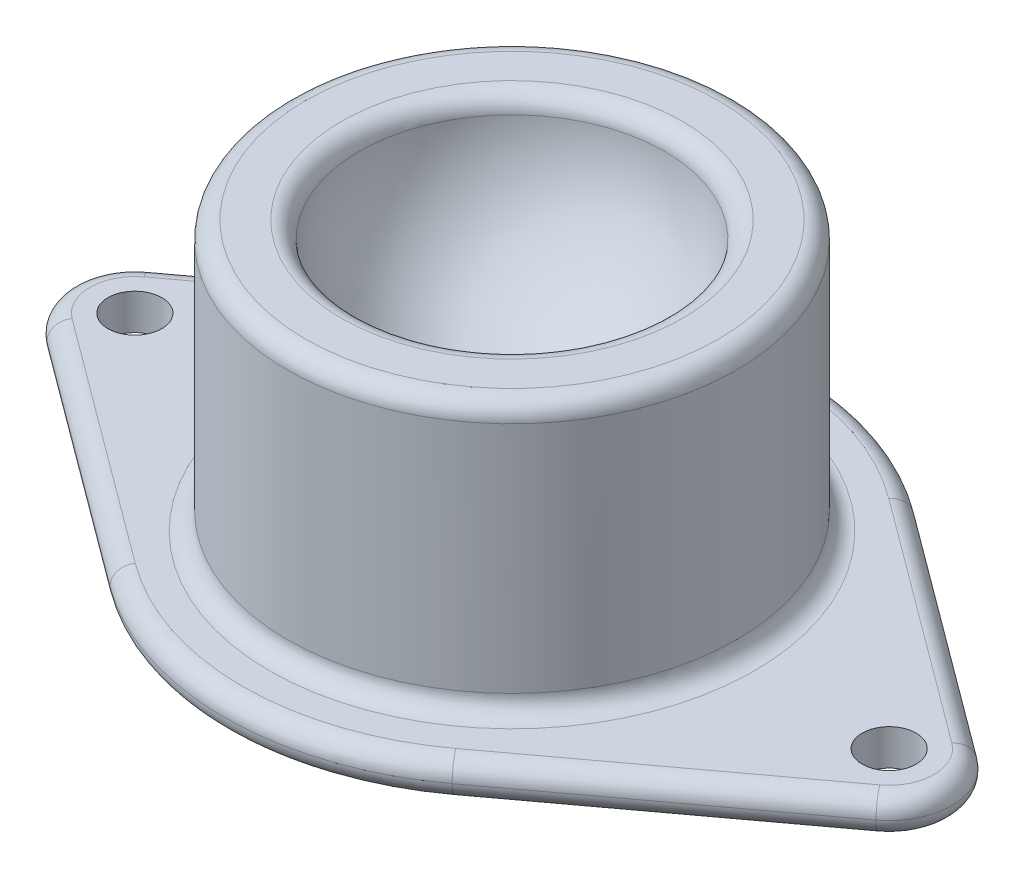
from build123d import *

# Parameters (mm, degrees)
SKETCH1_R           = 3.5
SKETCH1_R_2         = 1.5
SKETCH1_R_3         = 16
BOSS_EXTRUDE1_DEPTH = 2
FILLET1_R           = 1


with BuildPart() as part:
    # Sketch1 → Boss-Extrude1 (new body)
    # profile 1 of 5: a face of its own
    with BuildSketch(Plane(origin=(0, 0, 0), x_dir=(1, 0, 0), z_dir=(0, 1, 0))):
        with Locations((-21, 0)):
            Circle(SKETCH1_R)
        with Locations(Location((-21, 0, 0), (0, 0, 270))):
            Circle(SKETCH1_R_2, mode=Mode.SUBTRACT)
    # profile 2 of 5: a face of its own
    with BuildSketch(Plane(origin=(0, 0, 0), x_dir=(1, 0, 0), z_dir=(0, 1, 0))):
        with BuildLine():
            ThreePointArc((-9.523809524, -12.856790119), (-16, 0), (-9.523809524, 12.856790119))
            Line((-9.523809524, 12.856790119), (-23.083333333, 2.812422838))
            ThreePointArc((-23.083333333, 2.812422838), (-19.425463031, 3.125833222), (-17.5, 0))
            ThreePointArc((-17.5, 0), (-19.425463031, -3.125833222), (-23.083333333, -2.812422838))
            Line((-23.083333333, -2.812422838), (-9.523809524, -12.856790119))
        make_face()
    # profile 3 of 5: a face of its own
    with BuildSketch(Plane(origin=(0, 0, 0), x_dir=(1, 0, 0), z_dir=(0, 1, 0))):
        Circle(SKETCH1_R_3)
    # profile 4 of 5: a face of its own
    with BuildSketch(Plane(origin=(0, 0, 0), x_dir=(1, 0, 0), z_dir=(0, 1, 0))):
        with BuildLine():
            Line((23.083333333, 2.812422838), (9.523809524, 12.856790119))
            ThreePointArc((9.523809524, 12.856790119), (14.289523302, 7.197883287), (16, 0))
            ThreePointArc((16, 0), (14.289523302, -7.197883287), (9.523809524, -12.856790119))
            Line((9.523809524, -12.856790119), (23.083333333, -2.812422838))
            ThreePointArc((23.083333333, -2.812422838), (17.5, 0), (23.083333333, 2.812422838))
        make_face()
    # profile 5 of 5: a face of its own
    with BuildSketch(Plane(origin=(0, 0, 0), x_dir=(1, 0, 0), z_dir=(0, 1, 0))):
        with Locations((21, 0)):
            Circle(SKETCH1_R)
        with Locations(Location((21, 0, 0), (0, 0, 270))):
            Circle(SKETCH1_R_2, mode=Mode.SUBTRACT)
    extrude(amount=BOSS_EXTRUDE1_DEPTH)

    # Sketch3 → Revolve1 (revolve)
    with BuildSketch(Plane(origin=(0, 0, 0), x_dir=(0, 0, -1), z_dir=(1, 0, 0)), mode=Mode.PRIVATE) as revolve1_sk:
        with BuildLine():
            Line((-8.5, 17), (-12.5, 17))
            Line((-12.5, 17), (-12.5, 2))
            Line((-12.5, 2), (0, 2))
            Line((0, 2), (0, 8))
            ThreePointArc((0, 8), (-6.189709202, 10.668052421), (-8.5, 17))
        make_face()
    revolve(revolve1_sk.sketch.rotate(Axis((0, 2, 0), (0, 1, 0)), 180), axis=Axis((0, 2, 0), (0, 1, 0)))

    # Fillet1
    fillet1_edges = [part.edges().sort_by_distance(p)[0] for p in [
        (0, 2, 12.5),
        (0, 17, 12.5),
        (0, 17, 8.5),
        (16.303571429, 0, -7.834606479),
        (16.303571429, 2, -7.834606479),
        (24.5, 0, 0),
        (24.5, 2, 0),
        (16.303571429, 0, 7.834606479),
        (16.303571429, 2, 7.834606479),
        (0, 0, 16),
        (0, 2, 16),
        (-16.303571429, 0, 7.834606479),
        (-16.303571429, 2, 7.834606479),
        (-24.5, 0, 0),
        (-24.5, 2, 0),
        (-16.303571429, 0, -7.834606479),
        (-16.303571429, 2, -7.834606479),
        (0, 0, -16),
        (0, 2, -16),
    ]]
    fillet(fillet1_edges, radius=FILLET1_R - 0.0001)  # a hair under: the kernel refuses the full size


solid = part.part
